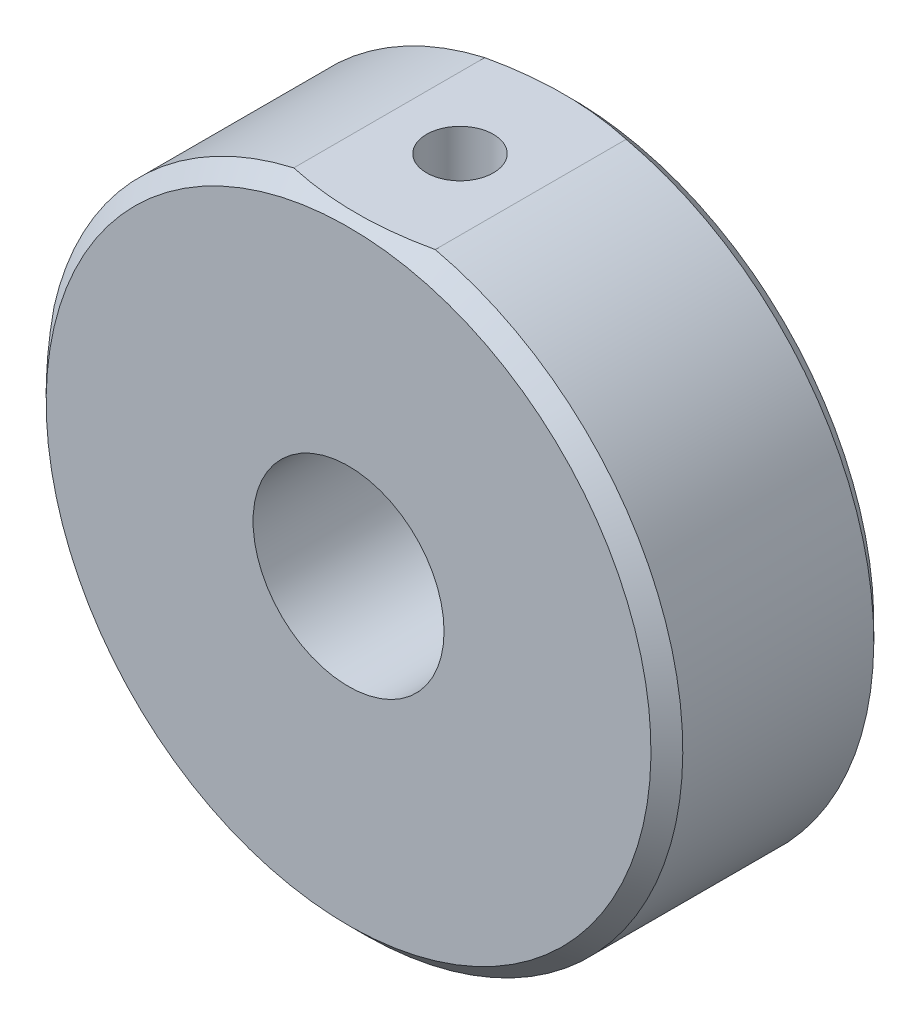
from build123d import *

# Parameters (mm, degrees)
SKETCH1_R              = 6
BOSS_EXTRUDE1_DEPTH    = 14
M5_TAPPED_HOLE1_REACH  = 48.435
M5_TAPPED_HOLE1_BORE_R = 2.1
CHAMFER1_SIZE          = 1


with BuildPart() as part:
    # Sketch1 → Boss-Extrude1 (new body)
    with BuildSketch(Plane.XY):
        with BuildLine():
            Line((-4.444097209, 19.5), (4.444097209, 19.5))
            ThreePointArc((4.444097209, 19.5), (14.142135624, -14.142135624), (-19.5, -4.444097209))
            Line((-19.5, -4.444097209), (-19.5, 4.444097209))
            ThreePointArc((-19.5, 4.444097209), (-14.142135624, 14.142135624), (-4.444097209, 19.5))
        make_face()
        Circle(SKETCH1_R, mode=Mode.SUBTRACT)
    extrude(amount=BOSS_EXTRUDE1_DEPTH)

    # M5 Tapped Hole1 bore → M5 Tapped Hole1 (cut, up to next)
    with BuildSketch(Plane(origin=(0, 19.5, 0), x_dir=(1, 0, 0), z_dir=(0, 1, 0)), mode=Mode.PRIVATE) as m5_tapped_hole1_sk1:
        with Locations((0, -7)):
            Circle(M5_TAPPED_HOLE1_BORE_R)
    m5_tapped_hole1_tool1 = extrude(m5_tapped_hole1_sk1.sketch, amount=-M5_TAPPED_HOLE1_REACH, mode=Mode.PRIVATE) & part.part
    add(m5_tapped_hole1_tool1.solids().sort_by_distance((0, 19.5, 7))[0], mode=Mode.SUBTRACT)

    # Chamfer1
    chamfer1_edges = [part.edges().sort_by_distance(p)[0] for p in [
        (14.142135624, -14.142135624, 0),
    ]]
    chamfer(chamfer1_edges, length=CHAMFER1_SIZE)
    chamfer1_2_edges = [part.edges().sort_by_distance(p)[0] for p in [
        (14.142135624, -14.142135624, 14),
    ]]
    chamfer(chamfer1_2_edges, length=CHAMFER1_SIZE)
    chamfer1_3_edges = [part.edges().sort_by_distance(p)[0] for p in [
        (-14.142135624, 14.142135624, 0),
    ]]
    chamfer(chamfer1_3_edges, length=CHAMFER1_SIZE - 0.0001)  # a hair under: the kernel refuses the full size
    chamfer1_4_edges = [part.edges().sort_by_distance(p)[0] for p in [
        (-14.142135624, 14.142135624, 14),
    ]]
    chamfer(chamfer1_4_edges, length=CHAMFER1_SIZE - 0.0001)  # a hair under: the kernel refuses the full size


solid = part.part
